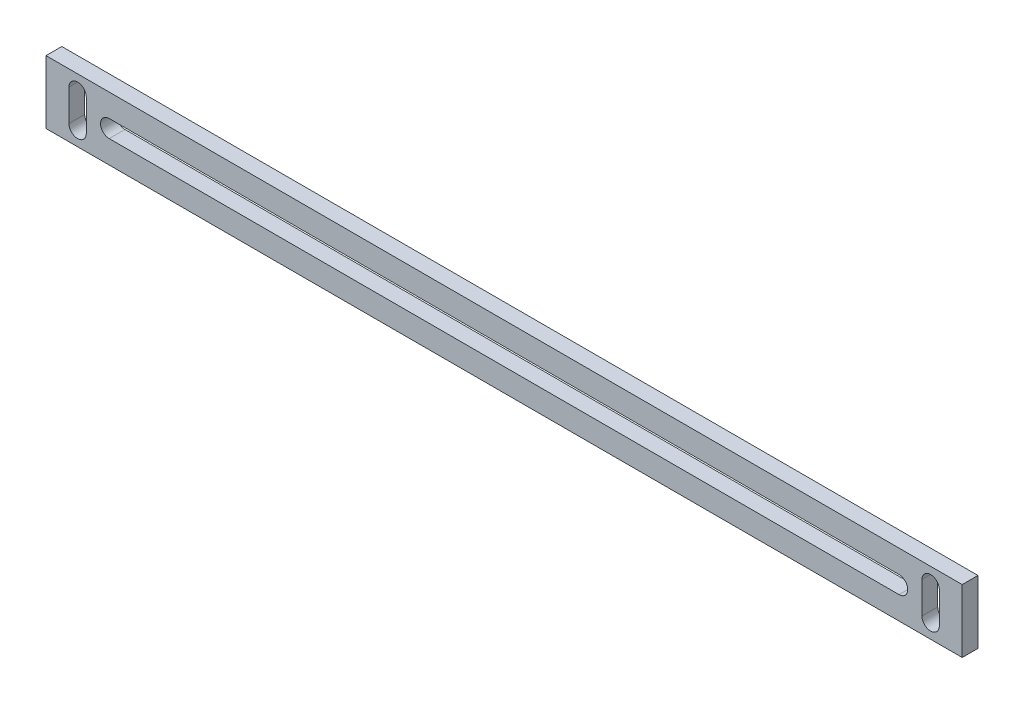
from build123d import *

# Parameters (mm, degrees)
EXTRUDE_1_DEPTH     = 5
CUT_EXTRUDE_1_DEPTH = 5


with BuildPart() as part:
    # 草图1 → 凸台-拉伸1 (new body)
    with BuildSketch(Plane.XY):
        Polygon((145, 10), (0, 10), (-145, 10), (-145, -10), (145, -10), align=None)
    extrude(amount=EXTRUDE_1_DEPTH)

    # 草图3 → 切除-拉伸1 (cut)
    with BuildSketch(Plane(origin=(0, 0, 0), x_dir=(-1, 0, 0), z_dir=(0, 0, -1))):
        with BuildLine():
            Line((-137.75, 5), (-137.75, -5))
            ThreePointArc((-137.75, -5), (-135, -7.75), (-132.25, -5))
            Line((-132.25, -5), (-132.25, 5))
            ThreePointArc((-132.25, 5), (-135, 7.75), (-137.75, 5))
        make_face()
        with BuildLine():
            Line((132.25, 5), (132.25, -5))
            ThreePointArc((132.25, -5), (135, -7.75), (137.75, -5))
            Line((137.75, -5), (137.75, 5))
            ThreePointArc((137.75, 5), (135, 7.75), (132.25, 5))
        make_face()
        with BuildLine():
            ThreePointArc((-125, 2.75), (-127.75, 0), (-125, -2.75))
            Line((-125, -2.75), (125, -2.75))
            ThreePointArc((125, -2.75), (127.75, 0), (125, 2.75))
            Line((125, 2.75), (-125, 2.75))
        make_face()
    extrude(amount=-CUT_EXTRUDE_1_DEPTH, mode=Mode.SUBTRACT)


solid = part.part
